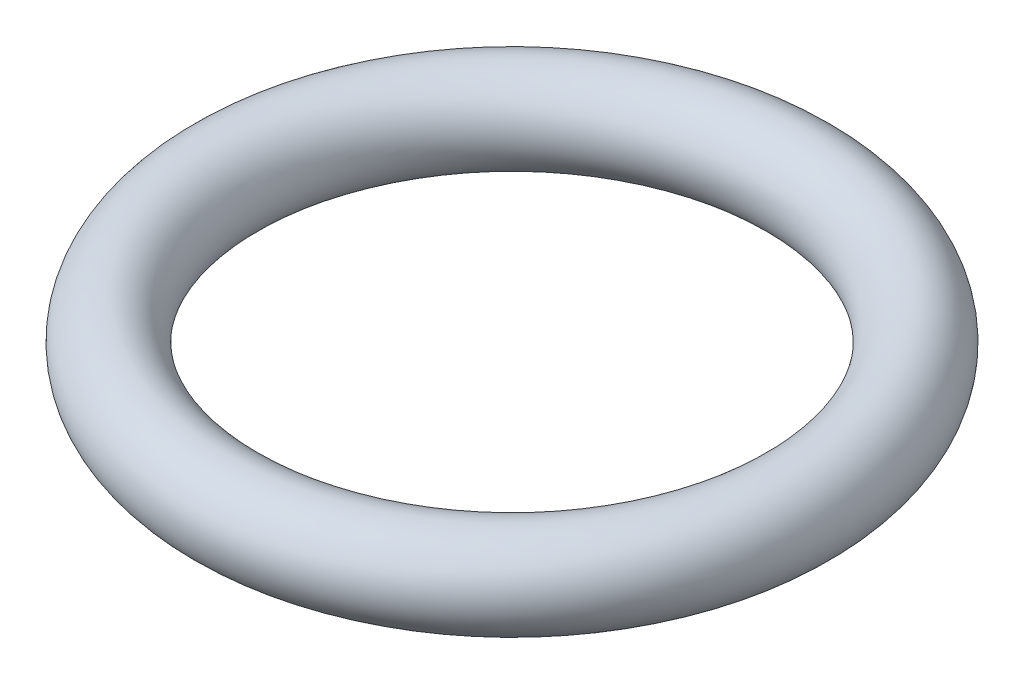
from build123d import *

# Parameters (mm, degrees)
SKETCH1_R = 0.85


with BuildPart() as part:
    # Sketch1 → Revolve1 (revolve)
    with BuildSketch(Plane.XY):
        with Locations((-5.5, 0)):
            Circle(SKETCH1_R)
    revolve(axis=Axis((0, -3.97209602, 0), (0, 1, 0)))


solid = part.part
